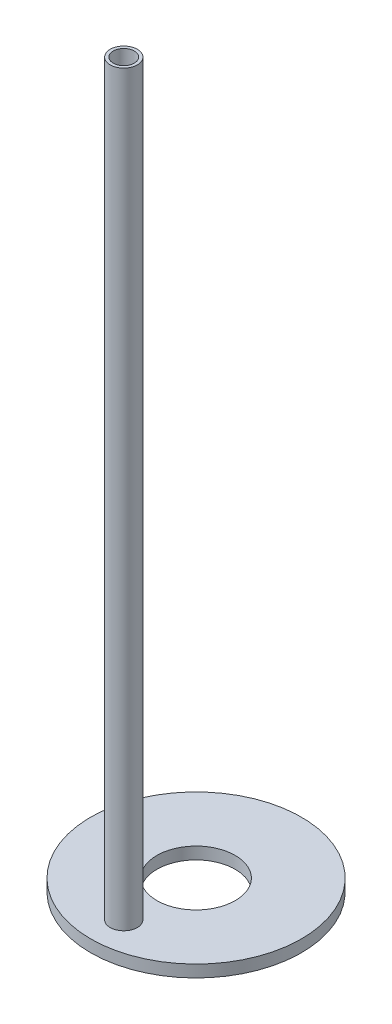
from build123d import *

# Parameters (mm, degrees)
SKETCH2_R          = 17.5
SKETCH2_R_2        = 6.5
PLATE_DEPTH        = 1
SKETCH2_4_R        = 2.25
ROD_DEPTH          = 125
SKETCH3_R          = 1.75
CUT_EXTRUDE1_DEPTH = 129.407554295


with BuildPart() as part:
    # Sketch2 → Plate (new, symmetric)
    with BuildSketch(Plane(origin=(0, 0, 0), x_dir=(1, 0, 0), z_dir=(0, 1, 0))):
        Circle(SKETCH2_R)
        Circle(SKETCH2_R_2, mode=Mode.SUBTRACT)
    extrude(amount=PLATE_DEPTH, both=True)

    # Sketch2<4> → Rod (add)
    with BuildSketch(Plane(origin=(0, 0, 0), x_dir=(1, 0, 0), z_dir=(0, 1, 0))):
        with Locations((0, -12)):
            Circle(SKETCH2_4_R)
    extrude(amount=ROD_DEPTH)

    # Sketch3 → Cut-Extrude1 (cut, through all)
    with BuildSketch(Plane(origin=(0, 125, 0), x_dir=(1, 0, 0), z_dir=(0, 1, 0))):
        with Locations((0, -12)):
            Circle(SKETCH3_R)
    extrude(amount=-CUT_EXTRUDE1_DEPTH, mode=Mode.SUBTRACT)


solid = part.part
